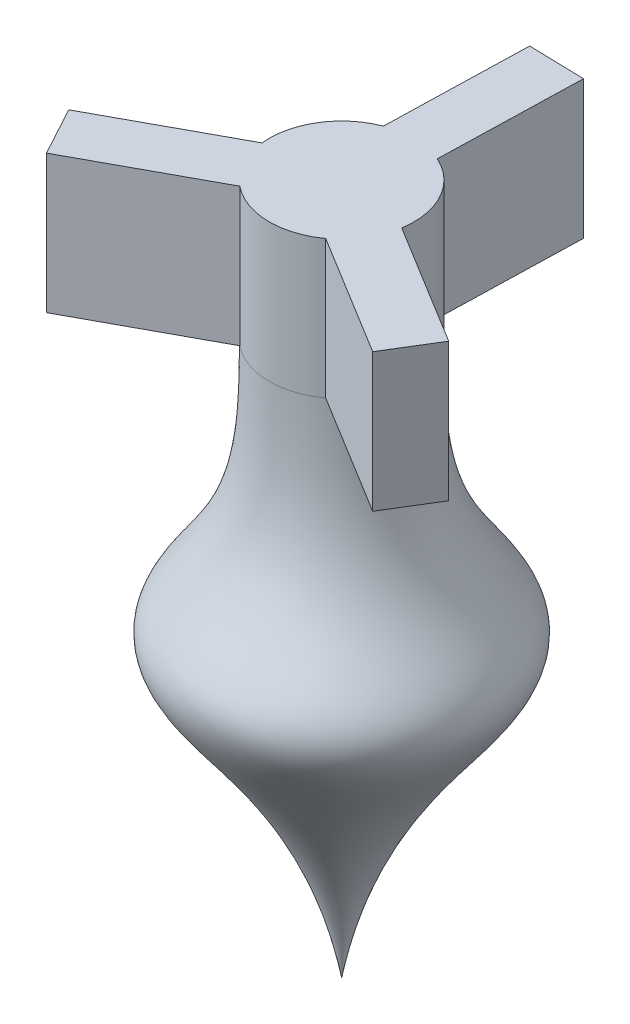
from build123d import *

# Parameters (mm, degrees)
BOSS_EXTRUDE3_START = 25
BOSS_EXTRUDE3_DEPTH = 25


# Read off the part's stored shape, not the designer's step: Revolve1
with BuildPart() as part:
    # Revolve1 outline → Revolve1 (revolve)
    with BuildSketch(Plane.XY):
        with BuildLine():
            add(Edge.make_bspline(
                [(0, -83.170194275), (9.196233186, -29.383544719), (56.312104062, -30.117818032), (14.458525258, -24.733147074), (13.097094087, -14.008197046), (13.097094087, 16.829805725)],
                knots=[0, 0, 0, 0, 0, 0, 1, 1, 1, 1, 1, 1], degree=5))
            Line((13.097094087, 16.829805725), (13.097094087, 41.829805725))
            Line((13.097094087, 41.829805725), (0, 41.829805725))
            Line((0, 41.829805725), (0, -83.170194275))
        make_face()
    revolve(axis=Axis((0, 0, 0), (0, 1, 0)))

    # Sketch5 → Boss-Extrude3 (add)
    with BuildSketch(Plane(origin=(0, 16.829805725, 0), x_dir=(1, 0, 0), z_dir=(0, 1, 0)).offset(BOSS_EXTRUDE3_START)):
        with BuildLine():
            Line((-30.925152295, -22.466241313), (-35.69384323, -13.676498042))
            Line((-35.69384323, -13.676498042), (-13.024433115, -1.377684848))
            ThreePointArc((-13.024433115, -1.377684848), (-11.512009462, -6.245599384), (-8.255742181, -10.167428119))
            Line((-8.255742181, -10.167428119), (-30.925152295, -22.466241313))
        make_face()
        with BuildLine():
            Line((29.691116354, -24.073525975), (34.918911852, -15.548846847))
            Line((34.918911852, -15.548846847), (12.933122133, -2.065968396))
            ThreePointArc((12.933122133, -2.065968396), (11.164852459, -6.846892951), (7.705326635, -10.590647524))
            Line((7.705326635, -10.590647524), (29.691116354, -24.073525975))
        make_face()
        with BuildLine():
            Line((6.002726876, 37.750024016), (5.319106481, 11.968332372))
            ThreePointArc((5.319106481, 11.968332372), (0.347157002, 13.092492335), (-4.677379952, 12.233396515))
            Line((-4.677379952, 12.233396515), (-3.993759557, 38.01508816))
            Line((-3.993759557, 38.01508816), (6.002726876, 37.750024016))
        make_face()
    extrude(amount=-BOSS_EXTRUDE3_DEPTH)


solid = part.part
